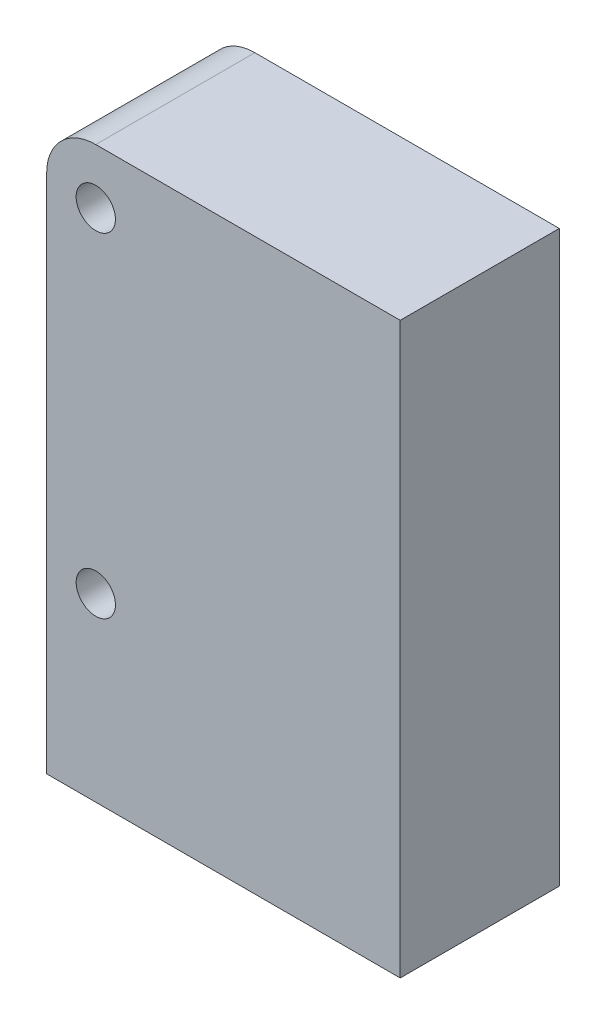
from build123d import *

# Parameters (mm, degrees)
ESQUISSE1_W             = 18
ESQUISSE1_H             = 29
BOSS_EXTRU_1_DEPTH      = 8.1
ESQUISSE3_R             = 1
ENL_V_MAT_EXTRU_1_DEPTH = 36.080051311
CONG_1_R                = 2.5


with BuildPart() as part:
    # Esquisse1 → Boss.-Extru.1 (new body)
    with BuildSketch(Plane.XY):
        with Locations((9, 14.5)):
            Rectangle(ESQUISSE1_W, ESQUISSE1_H)
    extrude(amount=BOSS_EXTRU_1_DEPTH)

    # Esquisse3 → Enlèv. mat.-Extru.1 (cut, through all)
    with BuildSketch(Plane.XY.offset(8.1)):
        with Locations((2.5, 26.2)):
            Circle(ESQUISSE3_R)
        with Locations((2.5, 9.2)):
            Circle(ESQUISSE3_R)
    extrude(amount=-ENL_V_MAT_EXTRU_1_DEPTH, mode=Mode.SUBTRACT)

    # Congé1
    cong_1_edges = [part.edges().sort_by_distance(p)[0] for p in [
        (0, 29, 4.05),
    ]]
    fillet(cong_1_edges, radius=CONG_1_R)


solid = part.part
